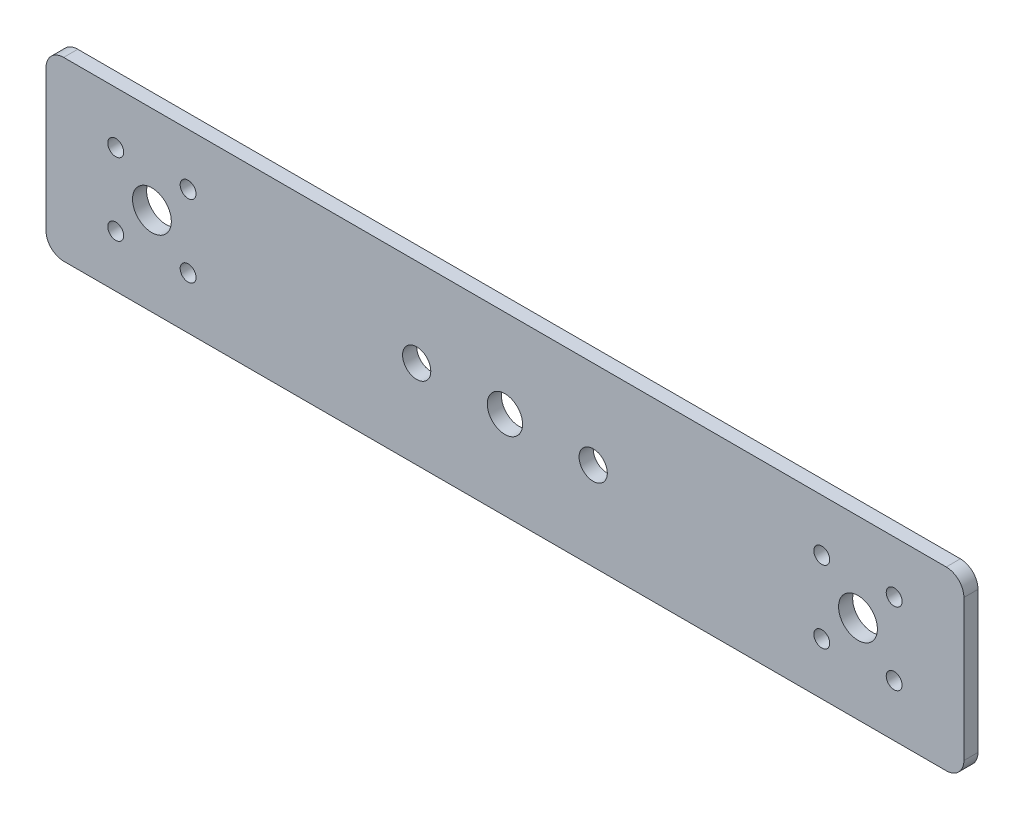
from build123d import *

# Parameters (mm, degrees)
SKETCH1_W          = 260
SKETCH1_H          = 50
BASE_FLANGE1_DEPTH = 4
SKETCH6_R          = 5.5
SKETCH6_R_2        = 5
SKETCH6_R_3        = 4
SKETCH6_R_4        = 2.25
CUT_EXTRUDE1_DEPTH = 10
FILLET1_R          = 5


# Sheet-metal steps are written as plain solids
with BuildPart() as part:
    # Sketch1 → Base-Flange1 (new body)
    with BuildSketch(Plane.XY):
        Rectangle(SKETCH1_W, SKETCH1_H)
    extrude(amount=-BASE_FLANGE1_DEPTH)

    # Sketch6 → Cut-Extrude1 (cut)
    with BuildSketch(Plane.XY):
        with Locations((100, 0)):
            Circle(SKETCH6_R)
        with Locations((-100, 0)):
            Circle(SKETCH6_R)
        Circle(SKETCH6_R_2)
        with Locations((-25, 0)):
            Circle(SKETCH6_R_3)
        with Locations(Location((25, 0, 0), (0, 0, 180))):
            Circle(SKETCH6_R_3)
        with Locations((110.253048327, 10.253048327)):
            Circle(SKETCH6_R_4)
        with Locations(Location((89.746951673, 10.253048327, 0), (0, 0, 180))):
            Circle(SKETCH6_R_4)
        with Locations((89.746951673, -10.253048327)):
            Circle(SKETCH6_R_4)
        with Locations(Location((110.253048327, -10.253048327, 0), (0, 0, 180))):
            Circle(SKETCH6_R_4)
        with Locations((-110.253048327, -10.253048327)):
            Circle(SKETCH6_R_4)
        with Locations(Location((-89.746951673, -10.253048327, 0), (0, 0, 180))):
            Circle(SKETCH6_R_4)
        with Locations((-89.746951673, 10.253048327)):
            Circle(SKETCH6_R_4)
        with Locations(Location((-110.253048327, 10.253048327, 0), (0, 0, 180))):
            Circle(SKETCH6_R_4)
    extrude(amount=-CUT_EXTRUDE1_DEPTH, mode=Mode.SUBTRACT)

    # Fillet1
    fillet1_edges = [part.edges().sort_by_distance(p)[0] for p in [
        (130, -25, -2),
        (-130, -25, -2),
        (-130, 25, -2),
        (130, 25, -2),
    ]]
    fillet(fillet1_edges, radius=FILLET1_R)


solid = part.part
